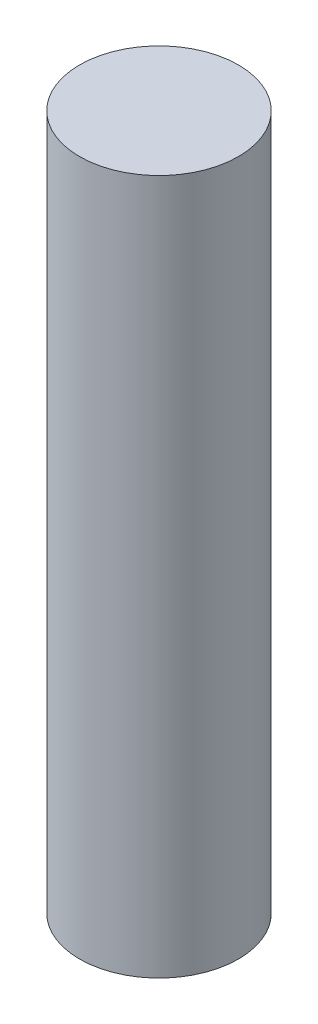
from build123d import *

# Parameters (mm, degrees)
SKETCH1_R           = 4
BOSS_EXTRUDE1_DEPTH = 35


with BuildPart() as part:
    # Sketch1 → Boss-Extrude1 (new body)
    with BuildSketch(Plane(origin=(0, 0, 0), x_dir=(1, 0, 0), z_dir=(0, 1, 0))):
        Circle(SKETCH1_R)
    extrude(amount=BOSS_EXTRUDE1_DEPTH)


solid = part.part
